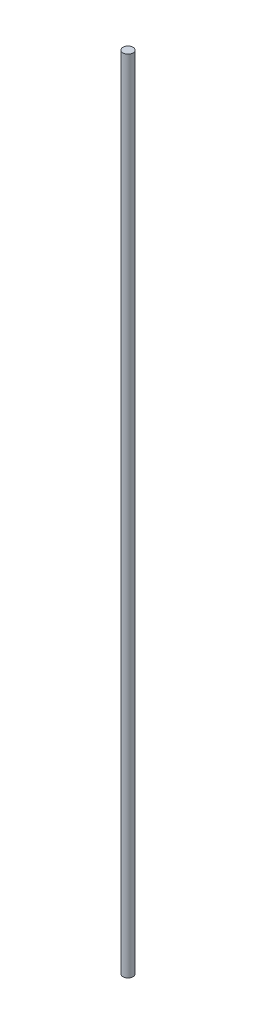
from build123d import *

# Parameters (mm, degrees)
SKETCH1_R           = 2.5
BOSS_EXTRUDE1_DEPTH = 400


with BuildPart() as part:
    # Sketch1 → Boss-Extrude1 (new body)
    with BuildSketch(Plane(origin=(0, 0, 0), x_dir=(1, 0, 0), z_dir=(0, 1, 0))):
        Circle(SKETCH1_R)
    extrude(amount=BOSS_EXTRUDE1_DEPTH)


solid = part.part
